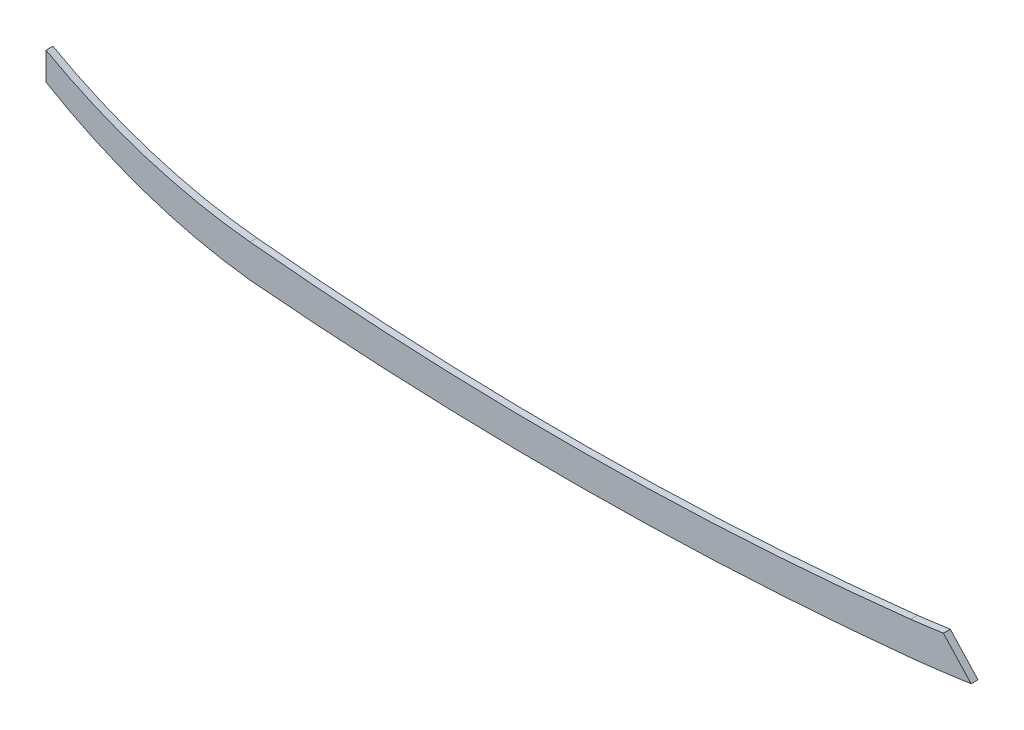
from build123d import *

# Parameters (mm, degrees)
BOSS_EXTRUDE1_DEPTH = 3.175


with BuildPart() as part:
    # Sketch2 → Boss-Extrude1 (new body)
    with BuildSketch(Plane.XY):
        with BuildLine():
            Line((0, -81.769447024), (0, -94.469447024))
            ThreePointArc((0, -94.469447024), (45.293757409, -115.460746442), (93.98, -126.497453101))
            ThreePointArc((93.98, -126.497453101), (247.132802315, -132.883361709), (400.203586987, -124.765753327))
            ThreePointArc((400.203586987, -124.765753327), (413.151657515, -123.199002254), (426.075201247, -121.441374098))
            Line((426.075201247, -121.441374099), (413.332408644, -107.633423764))
            ThreePointArc((413.332408644, -107.633423764), (405.778145977, -108.669642128), (398.217180602, -109.655763596))
            ThreePointArc((398.217180602, -109.655763596), (246.140678541, -118.451171226), (93.98, -111.257453101))
            ThreePointArc((93.98, -111.257453101), (45.478698707, -101.330055673), (0, -81.769447024))
        make_face()
    extrude(amount=BOSS_EXTRUDE1_DEPTH)


solid = part.part
